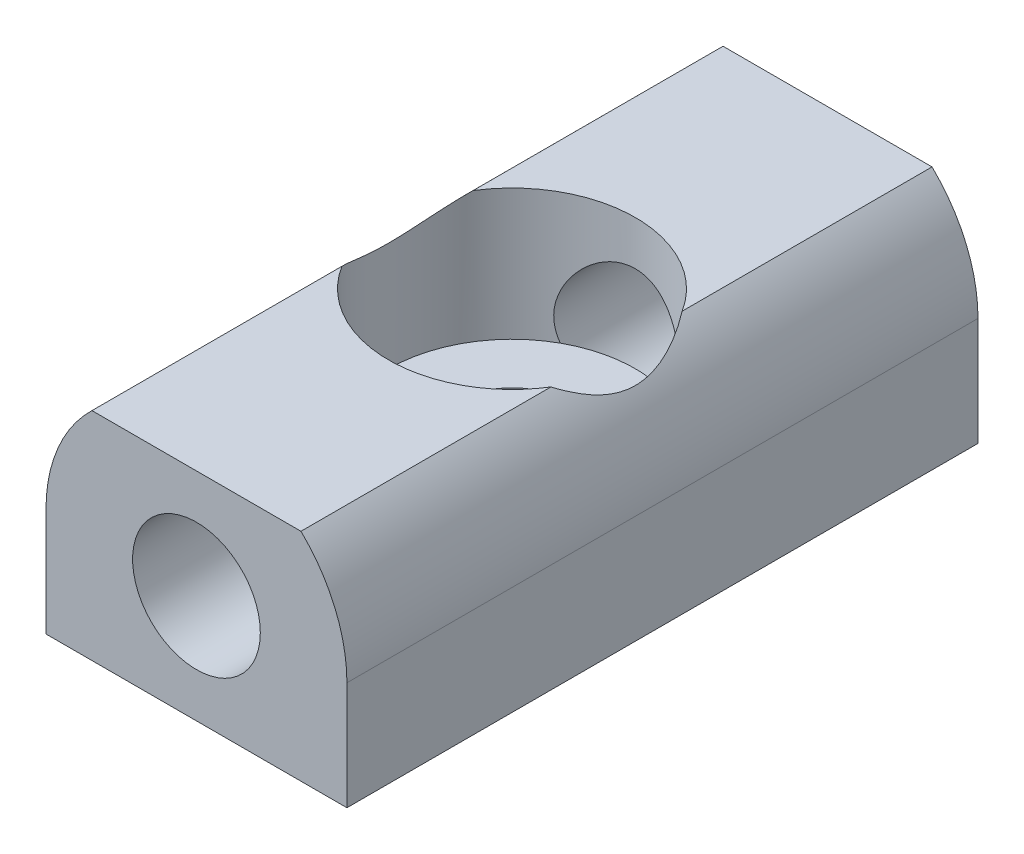
from build123d import *

# Parameters (mm, degrees)
SKETCH2_R             = 3.475
BOSS_EXTRUDE2_DEPTH   = 14.575
SKETCH3_R             = 1.475
CUT_EXTRUDE1_DEPTH    = 10
CUT_EXTRUDE2_START    = -10
SKETCH4_R             = 1.475
CUT_EXTRUDE2_DEPTH    = 10
BOSS_EXTRUDE3_DEPTH   = 14.575
SKETCH6_W             = 6.95
SKETCH6_H             = 14.575
BOSS_EXTRUDE4_DEPTH   = 0.2
SKETCH8_W             = 6
SKETCH8_H             = 2
CUT_EXTRUDE3_DEPTH    = 17.560155
SKETCH10_R            = 2.85
CUT_EXTRUDE4_DEPTH    = 3
SKETCH11_R            = 1.675
CUT_EXTRUDE5_DEPTH    = 16.508264
SKETCH17_R            = 2.85
BOSS_EXTRUDE8_DEPTH   = 3.15
BOSS_EXTRUDE9_DEPTH   = 0.150002
BOSS_EXTRUDE9_START   = 4.437502
BOSS_EXTRUDE9_2_DEPTH = 1.376058
BOSS_EXTRUDE9_START_2 = 2.475
BOSS_EXTRUDE9_3_DEPTH = 1.525
BOSS_EXTRUDE12_START  = 4
BOSS_EXTRUDE12_DEPTH  = 4
CUT_EXTRUDE6_DEPTH    = 17.322741
SKETCH23_R            = 1.475
CUT_EXTRUDE8_DEPTH    = 16.508264
SKETCH24_W            = 6.95
SKETCH24_H            = 1.175
CUT_EXTRUDE9_DEPTH    = 16.427634


with BuildPart() as part:
    # Sketch2 → Boss-Extrude2 (new body)
    with BuildSketch(Plane.XY):
        Circle(SKETCH2_R)
    extrude(amount=BOSS_EXTRUDE2_DEPTH)

    # Sketch3 → Cut-Extrude1 (cut)
    with BuildSketch(Plane.XY.offset(14.575)):
        Circle(SKETCH3_R)
    extrude(amount=-CUT_EXTRUDE1_DEPTH, mode=Mode.SUBTRACT)

    # Sketch4 → Cut-Extrude2 (cut)
    with BuildSketch(Plane(origin=(0, 0, 0), x_dir=(-1, 0, 0), z_dir=(0, 0, -1)).offset(CUT_EXTRUDE2_START)):
        with Locations(Location((0, 0, 0), (0, 0, 180))):
            Circle(SKETCH4_R)
    extrude(amount=CUT_EXTRUDE2_DEPTH, mode=Mode.SUBTRACT)

    # Sketch5 → Boss-Extrude3 (add)
    with BuildSketch(Plane(origin=(0, 0, 0), x_dir=(-1, 0, 0), z_dir=(0, 0, -1))):
        with BuildLine():
            ThreePointArc((0, -3.475), (-2.457196, -2.457196), (-3.475, 0))
            Line((-3.475, 0), (-3.475, -3.475))
            Line((-3.475, -3.475), (0, -3.475))
        make_face()
        with BuildLine():
            Line((3.475, -3.475), (3.475, 0))
            ThreePointArc((3.475, 0), (2.457196, -2.457196), (0, -3.475))
            Line((0, -3.475), (3.475, -3.475))
        make_face()
    extrude(amount=-BOSS_EXTRUDE3_DEPTH)

    # Sketch6 → Boss-Extrude4 (add)
    with BuildSketch(Plane.XZ.offset(3.475)):
        with Locations((0, 7.2875)):
            Rectangle(SKETCH6_W, SKETCH6_H)
    extrude(amount=BOSS_EXTRUDE4_DEPTH)

    # Sketch8 → Cut-Extrude3 (cut, through all)
    with BuildSketch(Plane.ZY.offset(3.475)):
        with Locations((7.2875, 3.475)):
            Rectangle(SKETCH8_W, SKETCH8_H)
    extrude(amount=-CUT_EXTRUDE3_DEPTH, mode=Mode.SUBTRACT)

    # Sketch10 → Cut-Extrude4 (cut)
    with BuildSketch(Plane(origin=(0, 2.475, 0), x_dir=(1, 0, 0), z_dir=(0, 1, 0))):
        with Locations(Location((0, -7.2875, 0), (0, 0, 298.924116))):
            Circle(SKETCH10_R)
    extrude(amount=-CUT_EXTRUDE4_DEPTH, mode=Mode.SUBTRACT)

    # Sketch11 → Cut-Extrude5 (cut, through all)
    with BuildSketch(Plane(origin=(0, -0.525, 0), x_dir=(1, 0, 0), z_dir=(0, 1, 0))):
        with Locations(Location((0, -7.2875, 0), (0, 0, 270))):
            Circle(SKETCH11_R)
    extrude(amount=-CUT_EXTRUDE5_DEPTH, mode=Mode.SUBTRACT)

    # Sketch17 → Boss-Extrude8 (add)
    with BuildSketch(Plane(origin=(0, -0.525, 0), x_dir=(1, 0, 0), z_dir=(0, 1, 0))):
        with Locations(Location((0, -7.2875, 0), (0, 0, 298.924116))):
            Circle(SKETCH17_R)
    extrude(amount=-BOSS_EXTRUDE8_DEPTH)

    # Boss-Extrude9: read off the stored shape, not the designer's step
    # Boss-Extrude9 outline → Boss-Extrude9 (add)
    with BuildSketch(Plane.XY.offset(4.2875)):
        with BuildLine():
            ThreePointArc((2.439262, 2.475), (0, 3.475), (-2.439262, 2.475))
            Line((-2.439262, 2.475), (2.439262, 2.475))
        make_face()
    extrude(amount=BOSS_EXTRUDE9_DEPTH)

    # Boss-Extrude9 2 outline → Boss-Extrude9 2 (add)
    with BuildSketch(Plane.XY.offset(BOSS_EXTRUDE9_START)):
        with BuildLine():
            ThreePointArc((2.439262, 2.475), (0, 3.475), (-2.439262, 2.475))
            Line((-2.439262, 2.475), (2.439262, 2.475))
        make_face()
    extrude(amount=BOSS_EXTRUDE9_2_DEPTH)

    # Boss-Extrude9 3 outline → Boss-Extrude9 3 (cut)
    with BuildSketch(Plane(origin=(0, 0, 0), x_dir=(1, 0, 0), z_dir=(0, 1, 0)).offset(BOSS_EXTRUDE9_START_2)):
        with BuildLine():
            ThreePointArc((-0.003518, -4.437502), (-1.401848, -4.806105), (-2.439262, -5.81356))
            Line((-2.439262, -5.81356), (2.439262, -5.81356))
            ThreePointArc((2.439262, -5.81356), (1.401848, -4.806105), (0.003518, -4.437502))
            Line((0.003518, -4.437502), (-0.003518, -4.437502))
        make_face()
    extrude(amount=BOSS_EXTRUDE9_3_DEPTH, mode=Mode.SUBTRACT)

    # Sketch20 → Boss-Extrude12 (add)
    with BuildSketch(Plane(origin=(0, 2.475, 0), x_dir=(1, 0, 0), z_dir=(0, 1, 0)).offset(BOSS_EXTRUDE12_START)):
        with BuildLine():
            Line((-2.439262, -10.2875), (2.439262, -10.2875))
            Line((2.439262, -10.2875), (2.439262, -8.76144))
            ThreePointArc((2.439262, -8.76144), (0, -10.1375), (-2.439262, -8.76144))
            Line((-2.439262, -8.76144), (-2.439262, -10.2875))
        make_face()
    extrude(amount=-BOSS_EXTRUDE12_DEPTH)

    # Sketch21 → Cut-Extrude6 (cut, through all)
    with BuildSketch(Plane.XY.offset(14.575)):
        with BuildLine():
            Line((-2.995994, 6.810074), (-2.799337, 2.058965))
            ThreePointArc((-2.799337, 2.058965), (-0.143714, 3.472027), (2.619604, 2.283265))
            Line((2.619604, 2.283265), (3.825654, 6.913781))
            Line((3.825654, 6.913781), (-2.995994, 6.810074))
        make_face()
    extrude(amount=-CUT_EXTRUDE6_DEPTH, mode=Mode.SUBTRACT)

    # Sketch23 → Cut-Extrude8 (cut, through all)
    with BuildSketch(Plane(origin=(0, -0.525, 0), x_dir=(1, 0, 0), z_dir=(0, 1, 0))):
        with Locations(Location((0, -7.2875, 0), (0, 0, 270))):
            Circle(SKETCH23_R)
    extrude(amount=-CUT_EXTRUDE8_DEPTH, mode=Mode.SUBTRACT)

    # Sketch24 → Cut-Extrude9 (cut, through all)
    with BuildSketch(Plane.XY.offset(14.575)):
        with BuildLine():
            ThreePointArc((2.413633, 2.5), (0, 3.475), (-2.413633, 2.5))
            Line((-2.413633, 2.5), (2.413633, 2.5))
        make_face()
        with Locations((0, -3.0875)):
            Rectangle(SKETCH24_W, SKETCH24_H)
    extrude(amount=-CUT_EXTRUDE9_DEPTH, mode=Mode.SUBTRACT)


solid = part.part
